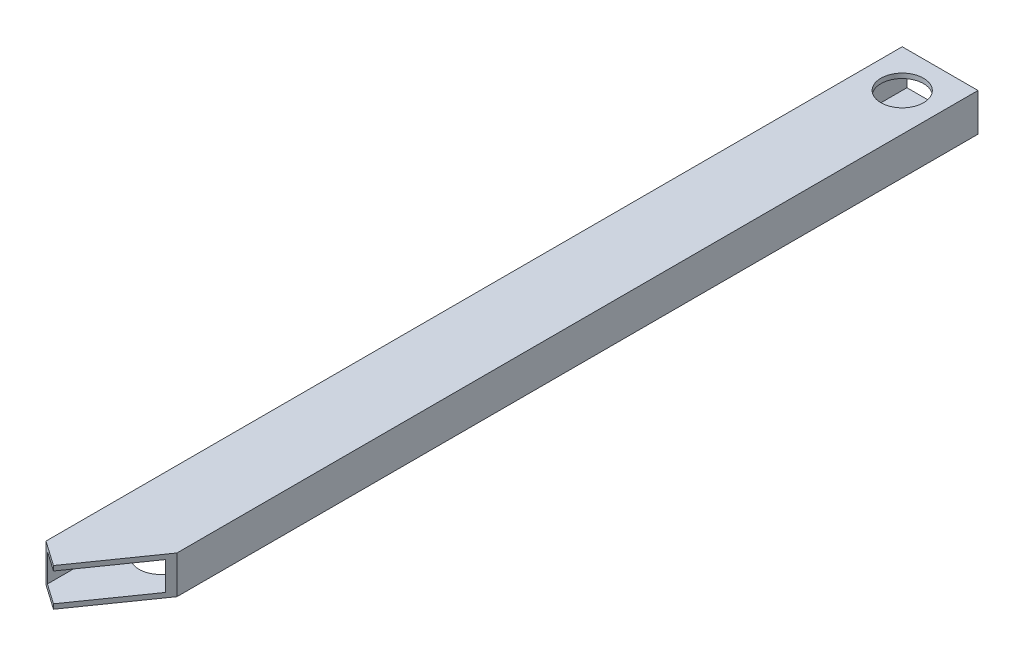
from build123d import *

# Parameters (mm, degrees)
SKETCH1_W           = 50.8
SKETCH1_H           = 25.4
BOSS_EXTRUDE1_DEPTH = 609.6
SKETCH2_W           = 44.45
SKETCH2_H           = 19.05
CUT_EXTRUDE1_DEPTH  = 609.6
SKETCH6_R           = 14.2875
CUT_EXTRUDE5_DEPTH  = 25.4
CUT_EXTRUDE6_DEPTH  = 25.4
SKETCH8_R           = 14.2875
CUT_EXTRUDE7_DEPTH  = 3.175


with BuildPart() as part:
    # Sketch1 → Boss-Extrude1 (new body)
    with BuildSketch(Plane.XY):
        with Locations((25.4, 12.7)):
            Rectangle(SKETCH1_W, SKETCH1_H)
    extrude(amount=BOSS_EXTRUDE1_DEPTH)

    # Sketch2 → Cut-Extrude1 (cut)
    with BuildSketch(Plane(origin=(0, 0, 0), x_dir=(-1, 0, 0), z_dir=(0, 0, -1))):
        with Locations((-25.4, 12.7)):
            Rectangle(SKETCH2_W, SKETCH2_H)
    extrude(amount=-CUT_EXTRUDE1_DEPTH, mode=Mode.SUBTRACT)

    # Sketch6 → Cut-Extrude5 (cut)
    with BuildSketch(Plane(origin=(0, 25.4, 0), x_dir=(1, 0, 0), z_dir=(0, 1, 0))):
        with Locations((25.4, -25.4)):
            Circle(SKETCH6_R)
    extrude(amount=-CUT_EXTRUDE5_DEPTH, mode=Mode.SUBTRACT)

    # Sketch7 → Cut-Extrude6 (cut)
    with BuildSketch(Plane(origin=(0, 25.4, 0), x_dir=(1, 0, 0), z_dir=(0, 1, 0))):
        Polygon((50.8, -537.050081257), (50.8, -609.6), (0, -609.6), (0, -574.029457059), (16.71268836, -585.731807432), align=None)
    extrude(amount=-CUT_EXTRUDE6_DEPTH, mode=Mode.SUBTRACT)

    # Sketch8 → Cut-Extrude7 (cut)
    with BuildSketch(Plane.XZ):
        with Locations((25.4, 522.762581257)):
            Circle(SKETCH8_R)
    extrude(amount=-CUT_EXTRUDE7_DEPTH, mode=Mode.SUBTRACT)


solid = part.part
